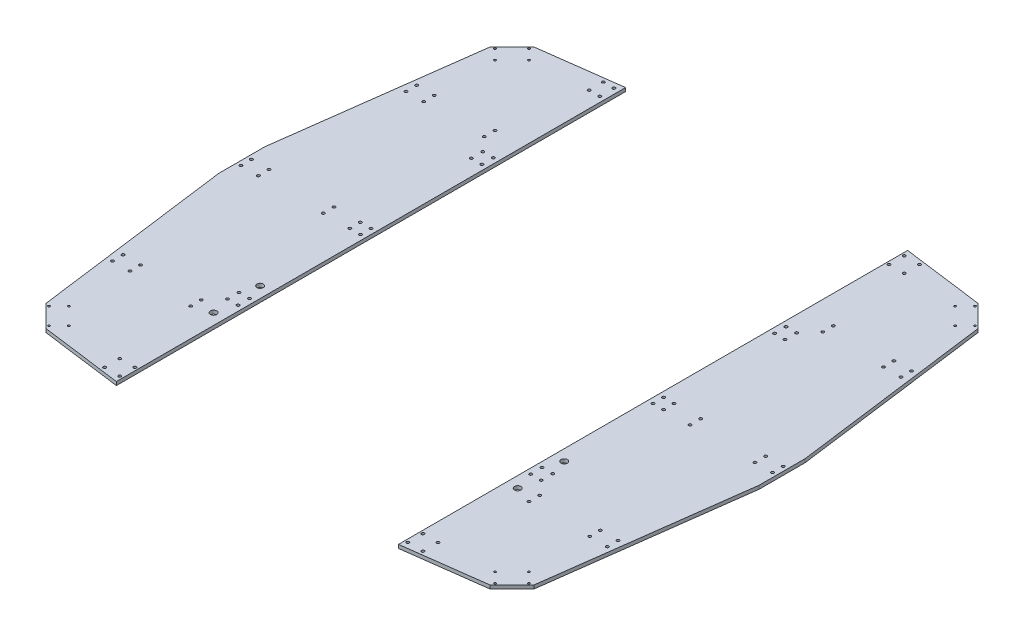
from build123d import *

# Parameters (mm, degrees)
SKETCH_1_R               = 1.5
SKETCH_1_R_2             = 1.999999999
SKETCH_1_R_3             = 2
SKETCH_1_R_4             = 4.5
SKETCH_1_R_5             = 2.000000001
SKETCH_1_R_6             = 2.000000002
SKETCH_1_R_7             = 250
SKETCH_1_R_8             = 1.999999995
EXTRUDE_2_DEPTH          = 5
CUT_EXTRUDE_1_DEPTH      = 542.772616539
CUT_EXTRUDE_1_DEPTH_BACK = 122
CUT_EXTRUDE_2_DEPTH      = 527.431195247
CUT_EXTRUDE_2_DEPTH_BACK = 39
SKETCH_3_R               = 1.999999999
CUT_EXTRUDE_3_DEPTH      = 20
CUT_EXTRUDE_3_DEPTH_BACK = 527.431195247
SKETCH_4_R               = 2.000000001
SKETCH_4_R_2             = 2
SKETCH_4_R_3             = 2.000000004
SKETCH_5_R               = 2.000000001
SKETCH_5_R_2             = 1.999999999
EXTRUDE_3_DEPTH          = 5


with BuildPart() as part:
    # 草图1 → 凸台-拉伸2 (new body)
    with BuildSketch(Plane(origin=(0, 0, 0), x_dir=(1, 0, 0), z_dir=(0, 1, 0))):
        Polygon((-32.720120418, 383.074776011), (-314.922171201, 345.922171201), (-345.922171201, 314.922171201), (-383.074776011, 32.720120418), (-383.074776011, -32.720120418), (-345.922171201, -314.922171201), (-314.922171201, -345.922171201), (-32.720120418, -383.074776011), (32.720120418, -383.074776011), (314.922171201, -345.922171201), (345.922171201, -314.922171201), (383.074776011, -32.720120418), (383.074776011, 32.720120418), (345.922171201, 314.922171201), (314.922171201, 345.922171201), (32.720120418, 383.074776011), (0, 383.074776011), align=None)
        with Locations((-316.280035574, -340.321666135)):
            Circle(SKETCH_1_R, mode=Mode.SUBTRACT)
        with Locations((-340.321666134, -316.280035574)):
            Circle(SKETCH_1_R, mode=Mode.SUBTRACT)
        with Locations((-302.137899951, -326.179530511)):
            Circle(SKETCH_1_R, mode=Mode.SUBTRACT)
        with Locations((-326.179530511, -302.137899951)):
            Circle(SKETCH_1_R, mode=Mode.SUBTRACT)
        with Locations((-350.918362048, -215.68195342)):
            Circle(SKETCH_1_R_2, mode=Mode.SUBTRACT)
        with Locations((-350.918362048, -200.68195342)):
            Circle(SKETCH_1_R_2, mode=Mode.SUBTRACT)
        with Locations((-325.918362048, -215.68195342)):
            Circle(SKETCH_1_R_2, mode=Mode.SUBTRACT)
        with Locations((-325.918362048, -200.68195342)):
            Circle(SKETCH_1_R_2, mode=Mode.SUBTRACT)
        with Locations((-240, -215.681953429)):
            Circle(SKETCH_1_R_3, mode=Mode.SUBTRACT)
        with Locations((-240, -200.681953429)):
            Circle(SKETCH_1_R_3, mode=Mode.SUBTRACT)
        with Locations((-215.612697258, -207.55428794)):
            Circle(SKETCH_1_R_4, mode=Mode.SUBTRACT)
        with Locations((-222.5, -181.030079822)):
            Circle(SKETCH_1_R_3, mode=Mode.SUBTRACT)
        with Locations((-207.5, -181.030079822)):
            Circle(SKETCH_1_R_3, mode=Mode.SUBTRACT)
        with Locations((-222.500000001, -164.825516547)):
            Circle(SKETCH_1_R_5, mode=Mode.SUBTRACT)
        with Locations((-207.500000001, -164.825516547)):
            Circle(SKETCH_1_R_5, mode=Mode.SUBTRACT)
        with Locations((-215.612697258, -141.55428794)):
            Circle(SKETCH_1_R_4, mode=Mode.SUBTRACT)
        with Locations((-377.074776011, -7.499878938)):
            Circle(SKETCH_1_R_3, mode=Mode.SUBTRACT)
        with Locations((-352.074776011, -7.499878938)):
            Circle(SKETCH_1_R_3, mode=Mode.SUBTRACT)
        with Locations((-260, -7.5)):
            Circle(SKETCH_1_R_3, mode=Mode.SUBTRACT)
        with Locations((316.280035574, -340.321666135)):
            Circle(SKETCH_1_R, mode=Mode.SUBTRACT)
        with Locations((302.13789995, -326.179530511)):
            Circle(SKETCH_1_R, mode=Mode.SUBTRACT)
        with Locations((326.179530511, -302.137899951)):
            Circle(SKETCH_1_R, mode=Mode.SUBTRACT)
        with Locations((340.321666135, -316.280035574)):
            Circle(SKETCH_1_R, mode=Mode.SUBTRACT)
        with Locations((215.612697258, -207.55428794)):
            Circle(SKETCH_1_R_4, mode=Mode.SUBTRACT)
        with Locations((240, -215.681953429)):
            Circle(SKETCH_1_R_3, mode=Mode.SUBTRACT)
        with Locations((240, -200.681953429)):
            Circle(SKETCH_1_R_3, mode=Mode.SUBTRACT)
        with Locations((325.918362043, -215.681953461)):
            Circle(SKETCH_1_R_6, mode=Mode.SUBTRACT)
        with Locations((325.918362043, -200.681953461)):
            Circle(SKETCH_1_R_6, mode=Mode.SUBTRACT)
        with Locations((350.918362043, -215.681953461)):
            Circle(SKETCH_1_R_6, mode=Mode.SUBTRACT)
        with Locations((350.918362043, -200.681953461)):
            Circle(SKETCH_1_R_6, mode=Mode.SUBTRACT)
        with Locations((207.5, -181.030079822)):
            Circle(SKETCH_1_R_3, mode=Mode.SUBTRACT)
        with Locations((222.5, -181.030079822)):
            Circle(SKETCH_1_R_3, mode=Mode.SUBTRACT)
        with Locations((207.500000001, -164.825516547)):
            Circle(SKETCH_1_R_5, mode=Mode.SUBTRACT)
        with Locations((222.500000001, -164.825516547)):
            Circle(SKETCH_1_R_5, mode=Mode.SUBTRACT)
        with Locations((215.612697258, -141.55428794)):
            Circle(SKETCH_1_R_4, mode=Mode.SUBTRACT)
        with Locations((260, -7.5)):
            Circle(SKETCH_1_R_3, mode=Mode.SUBTRACT)
        with Locations((352.074776011, -7.595099646)):
            Circle(SKETCH_1_R_3, mode=Mode.SUBTRACT)
        with Locations((377.074776011, -7.595099646)):
            Circle(SKETCH_1_R_3, mode=Mode.SUBTRACT)
        with Locations((-377.074776011, 7.500121062)):
            Circle(SKETCH_1_R_3, mode=Mode.SUBTRACT)
        with Locations((-352.074776011, 7.500121062)):
            Circle(SKETCH_1_R_3, mode=Mode.SUBTRACT)
        with Locations((-260, 7.5)):
            Circle(SKETCH_1_R_3, mode=Mode.SUBTRACT)
        with Locations((-222.500000001, 164.825516547)):
            Circle(SKETCH_1_R_5, mode=Mode.SUBTRACT)
        with Locations((-207.500000001, 164.825516547)):
            Circle(SKETCH_1_R_5, mode=Mode.SUBTRACT)
        with Locations((-222.5, 181.030079822)):
            Circle(SKETCH_1_R_3, mode=Mode.SUBTRACT)
        with Locations((-207.5, 181.030079822)):
            Circle(SKETCH_1_R_3, mode=Mode.SUBTRACT)
        with Locations((-350.918362048, 200.68195342)):
            Circle(SKETCH_1_R_6, mode=Mode.SUBTRACT)
        with Locations((-350.918362048, 215.68195342)):
            Circle(SKETCH_1_R_6, mode=Mode.SUBTRACT)
        with Locations((-325.918362048, 200.68195342)):
            Circle(SKETCH_1_R_6, mode=Mode.SUBTRACT)
        with Locations((-325.918362048, 215.68195342)):
            Circle(SKETCH_1_R_6, mode=Mode.SUBTRACT)
        with Locations((-240, 200.681953428)):
            Circle(SKETCH_1_R_3, mode=Mode.SUBTRACT)
        with Locations((-240, 215.681953428)):
            Circle(SKETCH_1_R_3, mode=Mode.SUBTRACT)
        with Locations((-340.321666134, 316.280035574)):
            Circle(SKETCH_1_R, mode=Mode.SUBTRACT)
        with Locations((-326.179530511, 302.137899951)):
            Circle(SKETCH_1_R, mode=Mode.SUBTRACT)
        with Locations((-302.13789995, 326.179530511)):
            Circle(SKETCH_1_R, mode=Mode.SUBTRACT)
        with Locations((-316.280035574, 340.321666134)):
            Circle(SKETCH_1_R, mode=Mode.SUBTRACT)
        Circle(SKETCH_1_R_7, mode=Mode.SUBTRACT)
        with Locations((260, 7.5)):
            Circle(SKETCH_1_R_3, mode=Mode.SUBTRACT)
        with Locations((352.074776011, 7.500121062)):
            Circle(SKETCH_1_R_3, mode=Mode.SUBTRACT)
        with Locations((377.074776011, 7.500121062)):
            Circle(SKETCH_1_R_3, mode=Mode.SUBTRACT)
        with Locations((207.500000001, 164.825516547)):
            Circle(SKETCH_1_R_2, mode=Mode.SUBTRACT)
        with Locations((222.500000001, 164.825516547)):
            Circle(SKETCH_1_R_2, mode=Mode.SUBTRACT)
        with Locations((207.5, 181.030079822)):
            Circle(SKETCH_1_R_3, mode=Mode.SUBTRACT)
        with Locations((222.5, 181.030079822)):
            Circle(SKETCH_1_R_3, mode=Mode.SUBTRACT)
        with Locations((240, 200.681953428)):
            Circle(SKETCH_1_R_3, mode=Mode.SUBTRACT)
        with Locations((240, 215.681953428)):
            Circle(SKETCH_1_R_3, mode=Mode.SUBTRACT)
        with Locations((325.918362043, 200.68195346)):
            Circle(SKETCH_1_R_8, mode=Mode.SUBTRACT)
        with Locations((325.918362043, 215.68195346)):
            Circle(SKETCH_1_R_8, mode=Mode.SUBTRACT)
        with Locations((350.918362043, 200.68195346)):
            Circle(SKETCH_1_R_8, mode=Mode.SUBTRACT)
        with Locations((350.918362043, 215.68195346)):
            Circle(SKETCH_1_R_8, mode=Mode.SUBTRACT)
        with Locations((326.179530511, 302.13789995)):
            Circle(SKETCH_1_R, mode=Mode.SUBTRACT)
        with Locations((302.137899951, 326.179530511)):
            Circle(SKETCH_1_R, mode=Mode.SUBTRACT)
        with Locations((340.321666135, 316.280035574)):
            Circle(SKETCH_1_R, mode=Mode.SUBTRACT)
        with Locations((316.280035574, 340.321666134)):
            Circle(SKETCH_1_R, mode=Mode.SUBTRACT)
    extrude(amount=EXTRUDE_2_DEPTH)

    # 草图2 → 切除-拉伸1 (cut, two sides: drawn at the far end of the back side and taken through both)
    with BuildSketch(Plane(origin=(0, 5, 0), x_dir=(1, 0, 0), z_dir=(0, 1, 0)).offset(-CUT_EXTRUDE_1_DEPTH_BACK)):
        Polygon((-200, 484.714921051), (-200, 361.051962068), (-200, -361.051962068), (-200, -418.819036359), (200, -418.819036359), (200, -361.051962068), (200, 361.051962068), (200, 484.714921051), align=None)
    extrude(amount=CUT_EXTRUDE_1_DEPTH + CUT_EXTRUDE_1_DEPTH_BACK, mode=Mode.SUBTRACT)


with BuildPart() as cut_extrude_1_piece_1:
    # of the separate pieces the step leaves, piece 1, a body of its own (cut_extrude_1_pieces)
    add(part.part.solids().sort_by_distance((200, 0, 361.051962068))[0])


with BuildPart() as cut_extrude_1_piece_2:
    # of the separate pieces the step leaves, piece 2, a body of its own (cut_extrude_1_pieces)
    add(part.part.solids().sort_by_distance((-314.922171201, 0, 345.922171201))[0])

    # 草图3 → 切除-拉伸2 (cut, two sides: drawn at the far end of the back side and taken through both)
    with BuildSketch(Plane(origin=(0, 0, 0), x_dir=(-1, 0, 0), z_dir=(0, -1, 0)).offset(-CUT_EXTRUDE_2_DEPTH_BACK)):
        with Locations((225.752728606, -352.02249242)):
            Circle(SKETCH_3_R)
        with Locations((204.247271397, -352.02249242)):
            Circle(SKETCH_3_R)
        with Locations((225.752728606, -330.517035211)):
            Circle(SKETCH_3_R)
        with Locations((204.247271397, -330.517035211)):
            Circle(SKETCH_3_R)
    extrude(amount=CUT_EXTRUDE_2_DEPTH + CUT_EXTRUDE_2_DEPTH_BACK, mode=Mode.SUBTRACT)


with BuildPart() as cut_extrude_3_tool:
    # 草图4 → 切除-拉伸3 (new, two sides: drawn at the far end of the back side and taken through both)
    with BuildSketch(Plane(origin=(0, 5, 0), x_dir=(1, 0, 0), z_dir=(0, 1, 0)).offset(-CUT_EXTRUDE_3_DEPTH_BACK)):
        with Locations((-207.500000001, 352.018568286)):
            Circle(SKETCH_4_R)
        with Locations((-222.500000001, 352.018568286)):
            Circle(SKETCH_4_R)
        with Locations((-222.500000001, 332.018568286)):
            Circle(SKETCH_4_R)
        with Locations((-207.500000001, 332.018568286)):
            Circle(SKETCH_4_R)
        with Locations((204.247271395, 330.513111077)):
            Circle(SKETCH_4_R_2)
        with Locations((225.752728605, 330.513111077)):
            Circle(SKETCH_4_R_2)
        with Locations((204.247271395, 352.018568286)):
            Circle(SKETCH_4_R_2)
        with Locations((225.752728605, 352.018568286)):
            Circle(SKETCH_4_R_2)
        with Locations((204.247271392, -352.022492421)):
            Circle(SKETCH_4_R_3)
        with Locations((225.752728601, -352.022492421)):
            Circle(SKETCH_4_R_3)
        with Locations((204.247271392, -330.517035211)):
            Circle(SKETCH_4_R_3)
        with Locations((225.752728601, -330.517035211)):
            Circle(SKETCH_4_R_3)
    extrude(amount=CUT_EXTRUDE_3_DEPTH + CUT_EXTRUDE_3_DEPTH_BACK)


with BuildPart() as cut_extrude_1_piece_1_1:
    add(cut_extrude_1_piece_1.part)

    # 切除-拉伸3: cut by cut_extrude_3_tool
    add(cut_extrude_3_tool.part, mode=Mode.SUBTRACT)



with BuildPart() as cut_extrude_1_piece_2_1:
    add(cut_extrude_1_piece_2.part)

    # 切除-拉伸3: cut by cut_extrude_3_tool
    add(cut_extrude_3_tool.part, mode=Mode.SUBTRACT)


with BuildPart() as cut_extrude_1_piece_1_2:
    add(cut_extrude_1_piece_1_1.part)

    add(cut_extrude_1_piece_2_1.part)  # 凸台-拉伸3 merges 切除-拉伸1 piece 2
    # 草图5 → 凸台-拉伸3 (add)
    # profile 1 of 2: a face of its own
    with BuildSketch(Plane(origin=(0, 5, 0), x_dir=(1, 0, 0), z_dir=(0, 1, 0))):
        with BuildLine():
            Line((-200, 7.5), (-200, 150))
            ThreePointArc((-200, 150), (-250, 0), (-200, -150))
            Line((-200, -150), (-200, -7.5))
            Line((-200.000000001, -7.5), (-200.000000001, 7.5))
        make_face()
        with Locations((-222.500000001, -7.5)):
            Circle(SKETCH_5_R, mode=Mode.SUBTRACT)
        with Locations((-207.500000001, -7.5)):
            Circle(SKETCH_5_R, mode=Mode.SUBTRACT)
        with Locations((-222.500000001, 7.5)):
            Circle(SKETCH_5_R, mode=Mode.SUBTRACT)
        with Locations((-207.500000001, 7.5)):
            Circle(SKETCH_5_R, mode=Mode.SUBTRACT)
    # profile 2 of 2: a face of its own
    with BuildSketch(Plane(origin=(0, 5, 0), x_dir=(1, 0, 0), z_dir=(0, 1, 0))):
        with BuildLine():
            ThreePointArc((200, -150), (250, 0), (200, 150))
            Line((200, 150), (200, -150))
        make_face()
        with Locations((207.500000001, -7.5)):
            Circle(SKETCH_5_R_2, mode=Mode.SUBTRACT)
        with Locations((222.500000001, -7.5)):
            Circle(SKETCH_5_R_2, mode=Mode.SUBTRACT)
        with Locations((207.500000001, 7.5)):
            Circle(SKETCH_5_R_2, mode=Mode.SUBTRACT)
        with Locations((222.500000001, 7.5)):
            Circle(SKETCH_5_R_2, mode=Mode.SUBTRACT)
    extrude(amount=-EXTRUDE_3_DEPTH)


solid = cut_extrude_1_piece_1_2.part
